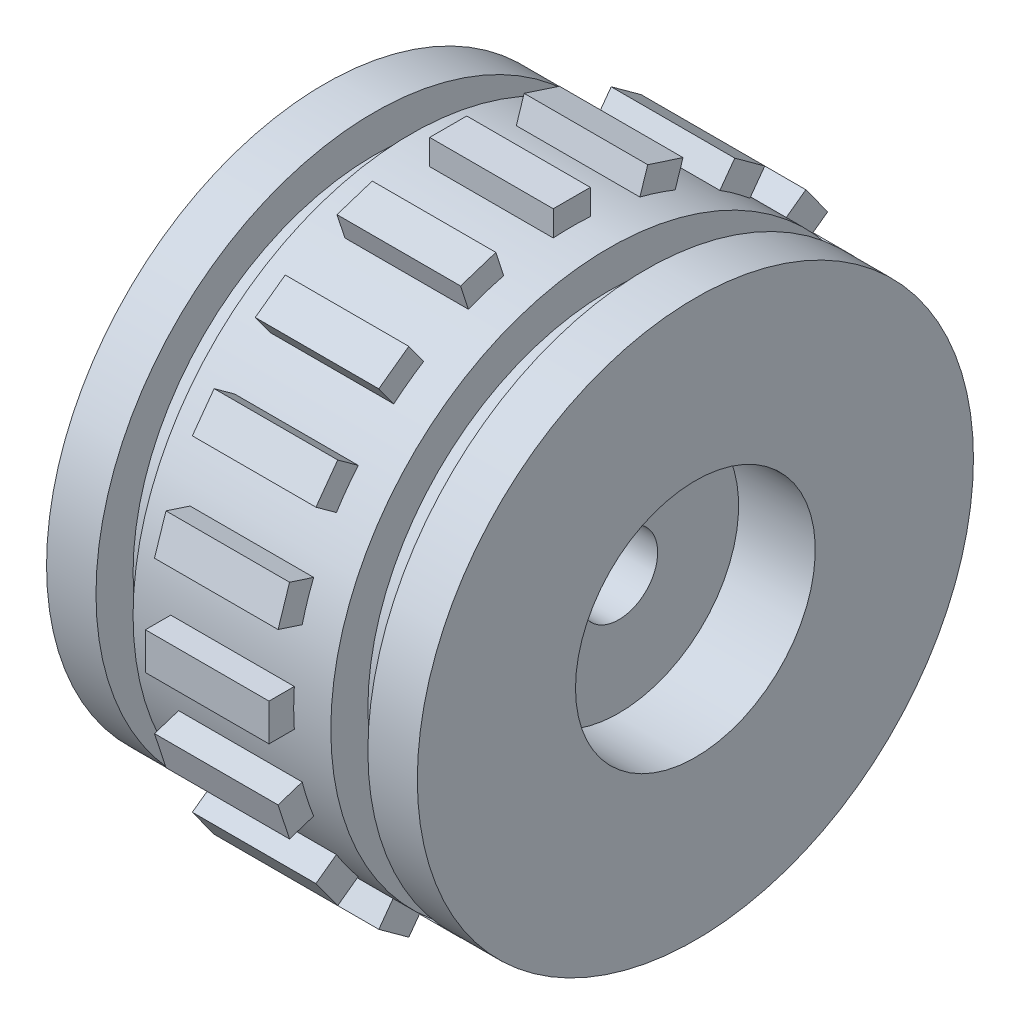
from build123d import *

# Parameters (mm, degrees)
CHAMFER_2_SIZE           = 2
SKETCH_6_W               = 3
SKETCH_6_H               = 4
SKETCH_7_W               = 10
SKETCH_7_H               = 3.436723268
EXTRUDE_1_DEPTH          = 1.5
PATTERN_CIRCULAR_1_COUNT = 20


with BuildPart() as part:
    # Эскиз4 → Повернуть1 (revolve)
    with BuildSketch(Plane.XY):
        Polygon((0, 22.5), (-30, 22.5), (-30, 18.5), (-19, 18.5), (-19, 5.1), (-13, 5.1), (-13, 3.15), (-6.2, 3.15), (-6.2, 9.7), (0, 9.7), align=None)
    revolve(axis=Axis((-30, 0, 0), (1, 0, 0)))

    # Фаска2
    chamfer_2_edges = [part.edges().sort_by_distance(p)[0] for p in [
        (-30, -18.5, 0),
        (-19, -18.5, 0),
    ]]
    chamfer(chamfer_2_edges, length=CHAMFER_2_SIZE)

    # Эскиз6 → Вырез-Повернуть2 (revolve, cut)
    with BuildSketch(Plane.XY):
        with Locations((-24.5, 21.5)):
            Rectangle(SKETCH_6_W, SKETCH_6_H)
        with Locations((-5.5, 21.5)):
            Rectangle(SKETCH_6_W, SKETCH_6_H)
    revolve(axis=Axis((-30, 0, 0), (1, 0, 0)), mode=Mode.SUBTRACT)

    # Эскиз7 → Бобышка-Вытянуть1 (add, symmetric)
    with BuildSketch(Plane.XY):
        with Locations((-15, 22.781638366)):
            Rectangle(SKETCH_7_W, SKETCH_7_H)
    extrude_1 = extrude(amount=EXTRUDE_1_DEPTH, both=True)

    # Круговой массив1: Бобышка-Вытянуть1 ×20 about axis
    pattern_circular_1_axis = Axis((-30, 0, 0), (-1, 0, 0))
    for i in range(1, PATTERN_CIRCULAR_1_COUNT):
        add(extrude_1.rotate(pattern_circular_1_axis, i * 360 / PATTERN_CIRCULAR_1_COUNT))


solid = part.part
